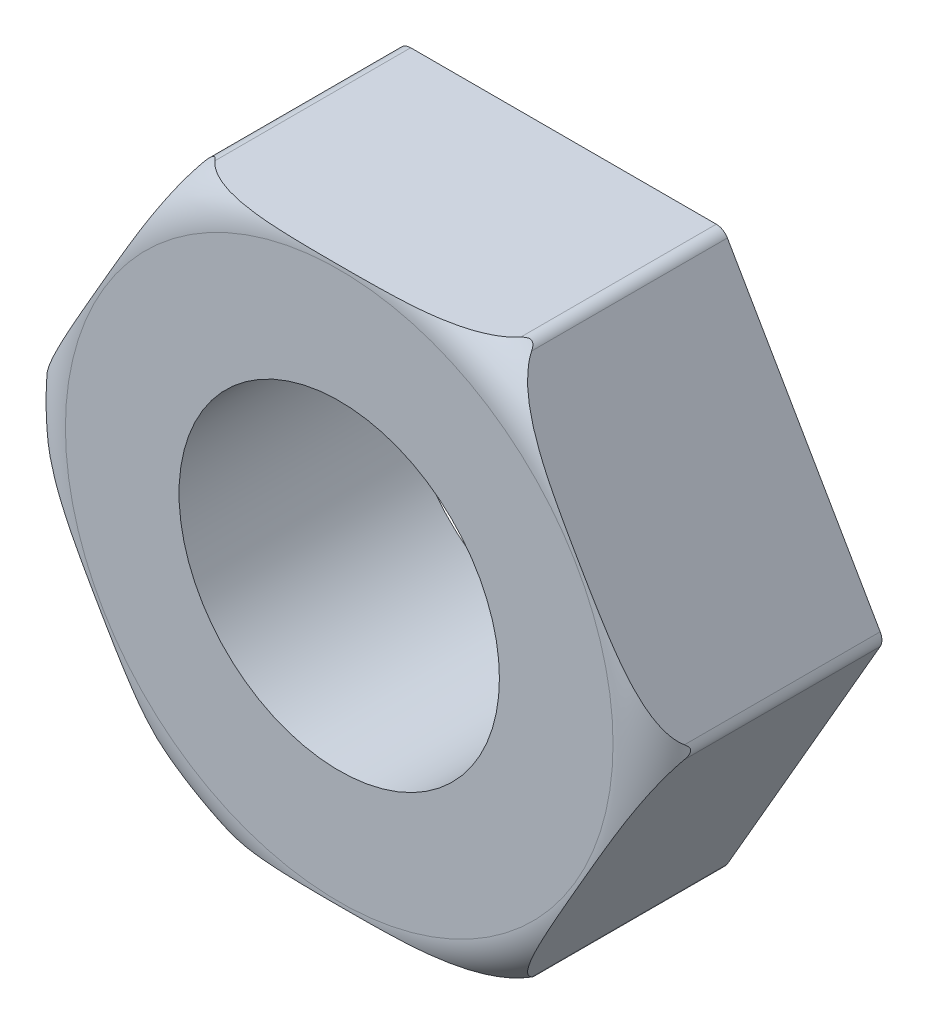
from build123d import *

# Parameters (mm, degrees)
SKETCH1_R      = 3.175
EXTRUDE1_DEPTH = 2.2225
FILLET2_R      = 0.254


with BuildPart() as part:
    # Sketch1 → Extrude1 (new, symmetric)
    with BuildSketch(Plane.XY):
        Polygon((3.175, 5.499261314), (-3.175, 5.499261314), (-6.35, 0), (-3.175, -5.499261314), (3.175, -5.499261314), (6.35, 0), align=None)
        Circle(SKETCH1_R, mode=Mode.SUBTRACT)
    extrude(amount=EXTRUDE1_DEPTH, both=True)

    # Sketch7 → Cut-Revolve2 (revolve, cut)
    with BuildSketch(Plane(origin=(0, 0, 0), x_dir=(1, 0, 0), z_dir=(0, 1, 0)), mode=Mode.PRIVATE) as cut_revolve2_sk:
        with BuildLine():
            Line((5.310988996, -2.2225), (5.427200903, -2.2225))
            ThreePointArc((5.427200903, -2.2225), (6.079718402, -1.952218402), (6.35, -1.299700903))
            Line((6.35, -1.299700903), (6.71065175, -1.932108982))
            ThreePointArc((6.71065175, -1.932108982), (6.182957857, -2.514615502), (5.427200903, -2.7305))
            Line((5.427200903, -2.7305), (5.310988996, -2.7305))
            Line((5.310988996, -2.7305), (5.310988996, -2.2225))
        make_face()
    revolve(cut_revolve2_sk.sketch.rotate(Axis((0, 0, -4.413769038), (0, 0, 1)), 180), axis=Axis((0, 0, -4.413769038), (0, 0, 1)), mode=Mode.SUBTRACT)

    # Fillet2
    # the kernel refuses this fillet: 0.254 mm, written as the material it takes off along each edge
    with BuildSketch(Plane(origin=(-3.175, 5.499261314, -2.589117421), x_dir=(1, 0, 0), z_dir=(0, 0, 1)), Plane(origin=(3.175, 5.499261314, 1.666318324), x_dir=(-1, 0, 0), z_dir=(0, 0, -1)), Plane(origin=(6.35, 0, 1.666318324), x_dir=(-0.5000000000000007, 0.8660254037844384, 0), z_dir=(0, 0, -1)), Plane(origin=(3.175, -5.499261314, 1.666318324), x_dir=(0.49999999999999906, 0.8660254037844392, 0), z_dir=(0, 0, -1)), Plane(origin=(-3.175, -5.499261314, -2.589117421), x_dir=(-0.4999999999999997, 0.8660254037844387, 0), z_dir=(0, 0, 1)), Plane(origin=(-6.35, 0, -2.589117421), x_dir=(0.4999999999999968, 0.8660254037844406, 0), z_dir=(0, 0, 1))) as fillet2_piece_1:
        with BuildLine():
            CenterArc((FILLET2_R * 0.57735026919, -FILLET2_R), FILLET2_R, 90, 60)
            Line((-FILLET2_R * 0.288675134595, -FILLET2_R * 0.5), (0, 0))
            Line((0, 0), (FILLET2_R * 0.57735026919, 0))
        make_face()
    extrude(amount=4.255435745, mode=Mode.SUBTRACT)


solid = part.part
